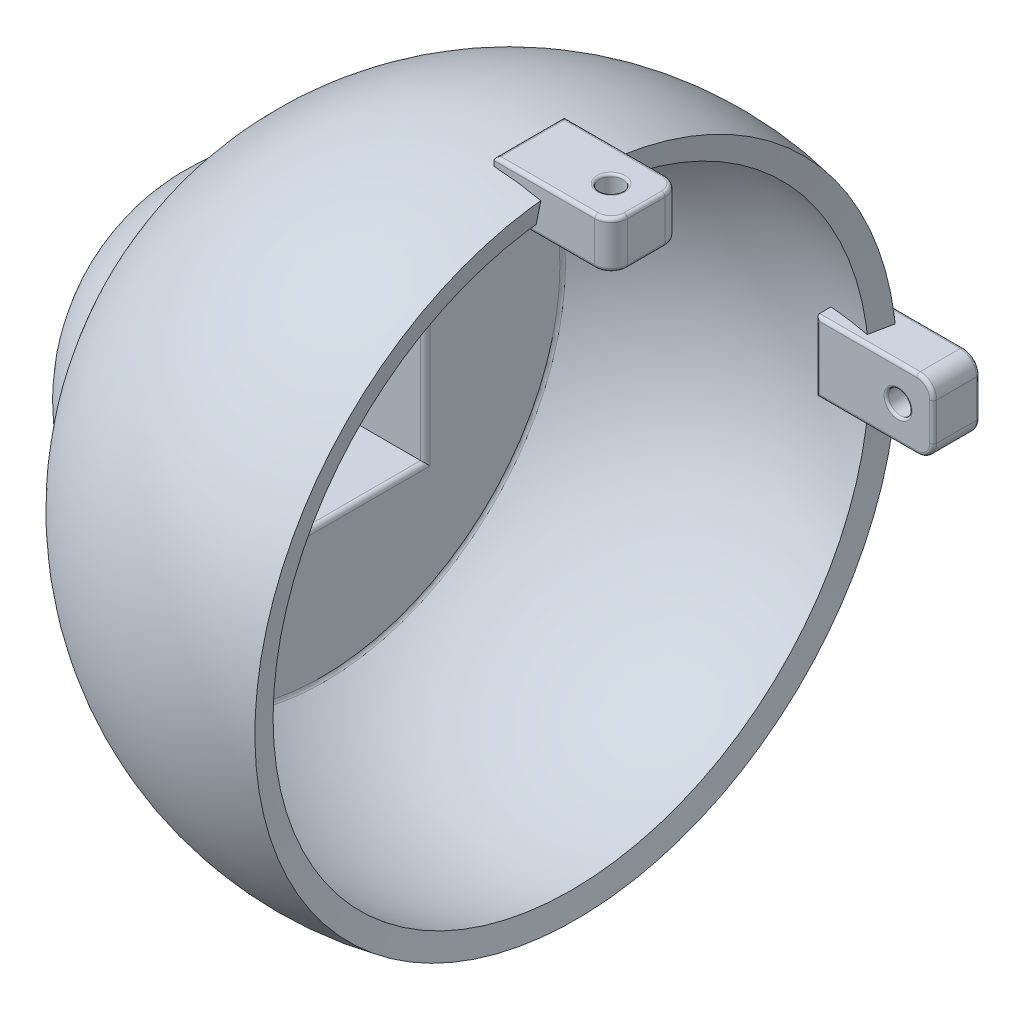
from build123d import *

# Parameters (mm, degrees)
SHELL3_T                        = -1
SKETCH3_R                       = 4.25
CUT_EXTRUDE2_DEPTH              = 71
EXTRUDE_THIN1_REACH             = 26.74
EXTRUDE_THIN1_END_RADIUS        = 7.082903769
SKETCH6_W                       = 9.8
SKETCH6_H                       = 9.911877538
SKETCH6_W_2                     = 8.8
SKETCH6_H_2                     = 8.911877538
EXTRUDE_THIN1_DIRECTION_2_DEPTH = 4
BOSS_EXTRUDE5_REACH             = 26.38
BOSS_EXTRUDE5_END_RADIUS        = 7.082903769
SKETCH8_W                       = 8.8
SKETCH8_H                       = 8.911877538
SKETCH8_R                       = 4.25
BOSS_EXTRUDE7_REACH             = 29.912
BOSS_EXTRUDE7_END_RADIUS        = 13
BOSS_EXTRUDE8_REACH             = 29.912
BOSS_EXTRUDE8_END_RADIUS        = 13
BOSS_EXTRUDE9_REACH             = 29.874
BOSS_EXTRUDE9_END_RADIUS        = 13
BOSS_EXTRUDE10_REACH            = 29.874
BOSS_EXTRUDE10_END_RADIUS       = 13
BOSS_EXTRUDE11_START            = 0.25
BOSS_EXTRUDE11_DEPTH            = 2
SKETCH17_R                      = 0.5
CUT_EXTRUDE3_DEPTH              = 2
FILLET1_R                       = 0.7
FILLET2_R                       = 0.15
FILLET9_R                       = 0.1
CIRPATTERN4_COUNT               = 2
CIRPATTERN4_ANGLE               = 90
FILLET6_R                       = 0.2
FILLET7_R                       = 0.2
FILLET8_R                       = 0.4


with BuildPart() as part:
    # Sketch2 → Revolve1 (revolve)
    with BuildSketch(Plane.XY):
        with BuildLine():
            Line((0, 0), (2.834192463, 13.710118639))
            ThreePointArc((2.834192463, 13.710118639), (-5.730026707, 12.773675819), (-12.124355653, 7))
            ThreePointArc((-12.124355653, 7), (-15.082903769, 4.041451884), (-16.165807537, 0))
            Line((-16.165807537, 0), (0, 0))
        make_face()
    revolve(axis=Axis((0, 0, 0), (-1, 0, 0)))

    # Shell3
    shell3_openings = [part.faces().sort_by_distance(p)[0] for p in [
        (1.417096231, -6.855059319, 0),
    ]]
    offset(amount=SHELL3_T, openings=shell3_openings, kind=Kind.INTERSECTION)

    # Sketch3 → Cut-Extrude2 (cut)
    with BuildSketch(Plane(origin=(0, 0, 0), x_dir=(0, 0, -1), z_dir=(1, 0, 0))):
        Circle(SKETCH3_R)
    extrude(amount=-CUT_EXTRUDE2_DEPTH, mode=Mode.SUBTRACT)

    # Extrude-Thin1: up to this sphere (the profile starts inside it)
    extrude_thin1_end = Location((-8.082903769, 0, 0)) * Sphere(EXTRUDE_THIN1_END_RADIUS, mode=Mode.PRIVATE)
    # Sketch6 → Extrude-Thin1 (add, up to the surface)
    with BuildSketch(Plane(origin=(-12, 0, 0), x_dir=(0, 0, -1), z_dir=(1, 0, 0)), mode=Mode.PRIVATE) as extrude_thin1_sk1:
        Rectangle(SKETCH6_W, SKETCH6_H)
        Rectangle(SKETCH6_W_2, SKETCH6_H_2, mode=Mode.SUBTRACT)
    extrude_thin1_tool1 = extrude(extrude_thin1_sk1.sketch, amount=-EXTRUDE_THIN1_REACH, mode=Mode.PRIVATE) & extrude_thin1_end
    add(extrude_thin1_tool1.solids().sort_by_distance((-12, -4.816553, 0))[0])
    add(extrude_thin1_tool1.solids().sort_by_distance((-12, -4.816553, 0))[1])
    add(extrude_thin1_tool1.solids().sort_by_distance((-12, -4.816553, 0))[2])
    add(extrude_thin1_tool1.solids().sort_by_distance((-12, -4.816553, 0))[3])

    # Sketch6 → Extrude-Thin1 direction 2 (add)
    with BuildSketch(Plane(origin=(-12, 0, 0), x_dir=(0, 0, -1), z_dir=(1, 0, 0))):
        Rectangle(SKETCH6_W, SKETCH6_H)
        Rectangle(SKETCH6_W_2, SKETCH6_H_2, mode=Mode.SUBTRACT)
    extrude(amount=EXTRUDE_THIN1_DIRECTION_2_DEPTH)

    # Boss-Extrude5: up to this sphere (the profile starts inside it)
    boss_extrude5_end = Location((-8.082903769, 0, 0)) * Sphere(BOSS_EXTRUDE5_END_RADIUS, mode=Mode.PRIVATE)
    # Sketch8 → Boss-Extrude5 (add, up to the surface)
    with BuildSketch(Plane(origin=(-11.392304845, 0, 0), x_dir=(0, 0, -1), z_dir=(1, 0, 0)), mode=Mode.PRIVATE) as boss_extrude5_sk1:
        Rectangle(SKETCH8_W, SKETCH8_H)
        Circle(SKETCH8_R, mode=Mode.SUBTRACT)
    boss_extrude5_tool1 = extrude(boss_extrude5_sk1.sketch, amount=-BOSS_EXTRUDE5_REACH, mode=Mode.PRIVATE) & boss_extrude5_end
    add(boss_extrude5_tool1.solids().sort_by_distance((-11.392305, 4.330694, 0))[0])

    # Boss-Extrude7: up to this sphere (the profile starts inside it)
    boss_extrude7_end = Location((0, 0, 0)) * Sphere(BOSS_EXTRUDE7_END_RADIUS, mode=Mode.PRIVATE)
    # Sketch12 → Boss-Extrude7 (add, up to the surface)
    with BuildSketch(Plane(origin=(0, 4.955938769, 0), x_dir=(1, 0, 0), z_dir=(0, 1, 0)), mode=Mode.PRIVATE) as boss_extrude7_sk1:
        with BuildLine():
            Line((-10.973999769, -4.9), (-8, -4.9))
            Line((-8, -4.9), (-8, 4.9))
            Line((-8, 4.9), (-10.973999769, 4.9))
            ThreePointArc((-10.973999769, 4.9), (-11.195988483, 4.369040262), (-11.392304845, 3.828062334))
            ThreePointArc((-11.392304845, 3.828062334), (-13.143160355, 0), (-11.392304845, -3.828062334))
            ThreePointArc((-11.392304845, -3.828062334), (-11.195988483, -4.369040262), (-10.973999769, -4.9))
        make_face()
    boss_extrude7_tool1 = extrude(boss_extrude7_sk1.sketch, amount=BOSS_EXTRUDE7_REACH, mode=Mode.PRIVATE) & boss_extrude7_end
    add(boss_extrude7_tool1.solids().sort_by_distance((-10.21205, 4.955939, 0))[0])

    # Boss-Extrude8: up to this sphere (the profile starts inside it)
    boss_extrude8_end = Location((0, 0, 0)) * Sphere(BOSS_EXTRUDE8_END_RADIUS, mode=Mode.PRIVATE)
    # Sketch13 → Boss-Extrude8 (add, up to the surface)
    with BuildSketch(Plane.XZ.offset(4.955938769), mode=Mode.PRIVATE) as boss_extrude8_sk1:
        with BuildLine():
            Line((-10.973999769, -4.9), (-8, -4.9))
            Line((-8, -4.9), (-8, 4.9))
            Line((-8, 4.9), (-10.973999769, 4.9))
            ThreePointArc((-10.973999769, 4.9), (-11.195988483, 4.369040262), (-11.392304845, 3.828062334))
            ThreePointArc((-11.392304845, 3.828062334), (-13.143160355, 0), (-11.392304845, -3.828062334))
            ThreePointArc((-11.392304845, -3.828062334), (-11.195988483, -4.369040262), (-10.973999769, -4.9))
        make_face()
    boss_extrude8_tool1 = extrude(boss_extrude8_sk1.sketch, amount=BOSS_EXTRUDE8_REACH, mode=Mode.PRIVATE) & boss_extrude8_end
    add(boss_extrude8_tool1.solids().sort_by_distance((-10.21205, -4.955939, 0))[0])

    # Boss-Extrude9: up to this sphere (the profile starts inside it)
    boss_extrude9_end = Location((0, 0, 0)) * Sphere(BOSS_EXTRUDE9_END_RADIUS, mode=Mode.PRIVATE)
    # Sketch14 → Boss-Extrude9 (add, up to the surface)
    with BuildSketch(Plane.XY.offset(4.9), mode=Mode.PRIVATE) as boss_extrude9_sk1:
        with BuildLine():
            Line((-8, -8.999444427), (-8, 8.999444427))
            ThreePointArc((-8, 8.999444427), (-10.025864662, 6.668735846), (-11.392304845, 3.899408969))
            ThreePointArc((-11.392304845, 3.899408969), (-13.197346631, 0), (-11.392304845, -3.899408969))
            ThreePointArc((-11.392304845, -3.899408969), (-10.025864662, -6.668735846), (-8, -8.999444427))
        make_face()
    boss_extrude9_tool1 = extrude(boss_extrude9_sk1.sketch, amount=BOSS_EXTRUDE9_REACH, mode=Mode.PRIVATE) & boss_extrude9_end
    add(boss_extrude9_tool1.solids().sort_by_distance((-9.949858, 0, 4.9))[0])

    # Boss-Extrude10: up to this sphere (the profile starts inside it)
    boss_extrude10_end = Location((0, 0, 0)) * Sphere(BOSS_EXTRUDE10_END_RADIUS, mode=Mode.PRIVATE)
    # Sketch15 → Boss-Extrude10 (add, up to the surface)
    with BuildSketch(Plane(origin=(0, 0, -4.9), x_dir=(-1, 0, 0), z_dir=(0, 0, -1)), mode=Mode.PRIVATE) as boss_extrude10_sk1:
        with BuildLine():
            Line((8, 8.999444427), (8, -8.999444427))
            ThreePointArc((8, -8.999444427), (10.025864662, -6.668735846), (11.392304845, -3.899408969))
            ThreePointArc((11.392304845, -3.899408969), (13.197346631, 0), (11.392304845, 3.899408969))
            ThreePointArc((11.392304845, 3.899408969), (10.025864662, 6.668735846), (8, 8.999444427))
        make_face()
    boss_extrude10_tool1 = extrude(boss_extrude10_sk1.sketch, amount=BOSS_EXTRUDE10_REACH, mode=Mode.PRIVATE) & boss_extrude10_end
    add(boss_extrude10_tool1.solids().sort_by_distance((-9.949858, 0, -4.9))[0])

    # Fillet6
    fillet6_edges = [part.edges().sort_by_distance(p)[0] for p in [
        (-8, 0, 4.4),
        (-8, -4.455938769, 0),
        (-8, 0, -4.4),
        (-8, 4.455938769, 0),
        (-8, -10.246950766, 0),
    ]]
    fillet(fillet6_edges, radius=FILLET6_R)

    # Fillet7
    fillet7_edges = [part.edges().sort_by_distance(p)[0] for p in [
        (-14.958282546, 3.00520382, -3.00520382),
        (-11.392304845, 0, 4.25),
    ]]
    fillet(fillet7_edges, radius=FILLET7_R)

    # Fillet8
    fillet8_edges = [part.edges().sort_by_distance(p)[0] for p in [
        (-12.124355653, -7, 0),
    ]]
    fillet(fillet8_edges, radius=FILLET8_R)


with BuildPart() as body_2:
    # Sketch16 → Boss-Extrude11 (new body)
    with BuildSketch(Plane(origin=(0, 0, -14), x_dir=(-1, 0, 0), z_dir=(0, 0, -1)).offset(BOSS_EXTRUDE11_START)):
        Polygon((-5.834192463, 1.5), (-2.834192463, 1.5), (-0.834192463, 1.5), (-0.834192463, -1.5), (-2.834192463, -1.5), (-5.834192463, -1.5), align=None)
    extrude(amount=-BOSS_EXTRUDE11_DEPTH)

    # Sketch17 → Cut-Extrude3 (cut)
    with BuildSketch(Plane(origin=(0, 13.25, -14.25), x_dir=(1, 0, 0), z_dir=(0, 0, 1))):
        with Locations((4.334192463, -13.25)):
            Circle(SKETCH17_R)
    extrude(amount=CUT_EXTRUDE3_DEPTH, mode=Mode.SUBTRACT)

    # Fillet1
    fillet1_edges = [body_2.edges().sort_by_distance(p)[0] for p in [
        (5.834192463, -1.5, -13.25),
        (5.834192463, 1.5, -13.25),
    ]]
    fillet(fillet1_edges, radius=FILLET1_R)

    # Fillet2
    fillet2_edges = [body_2.edges().sort_by_distance(p)[0] for p in [
        (2.984192463, 1.5, -14.25),
        (2.984192463, 1.5, -12.25),
        (2.984192463, -1.5, -12.25),
        (2.984192463, -1.5, -14.25),
        (0.834192463, 0, -12.25),
        (0.834192463, 0, -14.25),
        (5.62916721, -1.294974747, -14.25),
        (5.834192463, 0, -14.25),
        (5.62916721, 1.294974747, -14.25),
        (5.62916721, -1.294974747, -12.25),
        (5.834192463, 0, -12.25),
        (5.62916721, 1.294974747, -12.25),
    ]]
    fillet(fillet2_edges, radius=FILLET2_R)

    # Fillet9
    fillet9_edges = [body_2.edges().sort_by_distance(p)[0] for p in [
        (3.834192463, 0, -12.25),
        (3.834192463, 0, -14.25),
    ]]
    fillet(fillet9_edges, radius=FILLET9_R)


with BuildPart() as cirpattern4_1:
    # CirPattern4: pattern copy
    add(body_2.part.rotate(Axis((-17.248382677, 0, 0), (1, 0, 0)), 1 * CIRPATTERN4_ANGLE / (CIRPATTERN4_COUNT - 1)))


solid = Compound([part.part, body_2.part, cirpattern4_1.part])
